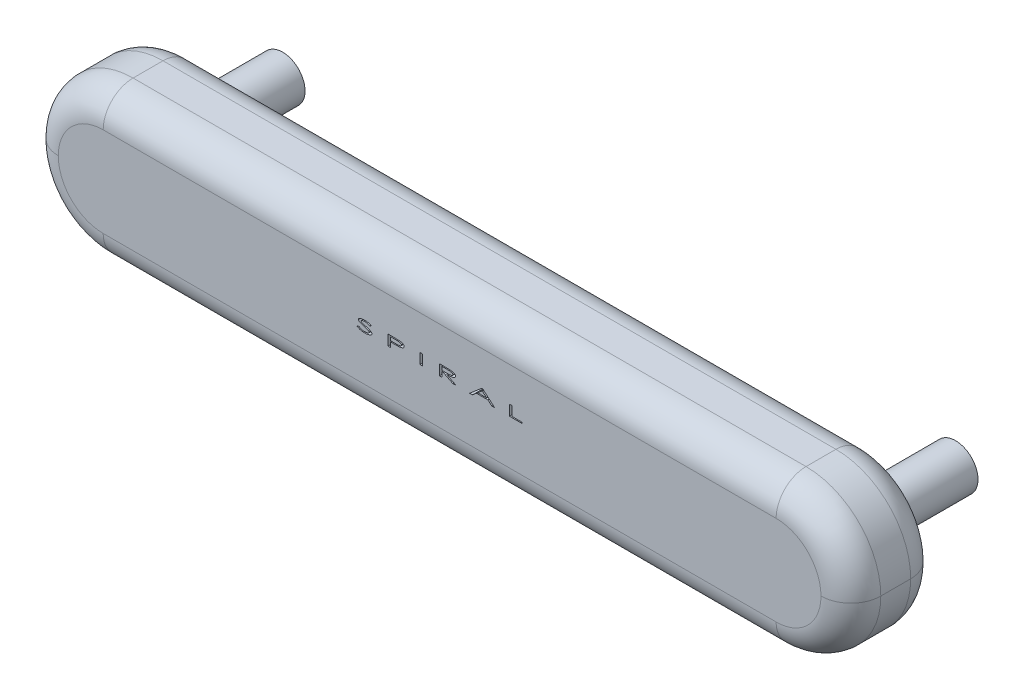
from build123d import *

# Parameters (mm, degrees)
CROQUIS1_W              = 275
CROQUIS1_H              = 50
SALIENTE_EXTRUIR1_DEPTH = 30
REDONDEO1_R             = 25
CROQUIS1_3_R            = 7.5
SALIENTE_EXTRUIR2_DEPTH = 30
CROQUIS1_4_R            = 7.5
SALIENTE_EXTRUIR3_DEPTH = 30
REDONDEO2_R             = 10
CROQUIS2_W              = 0.852564103
CROQUIS2_H              = 3.5
CORTAR_EXTRUIR1_DEPTH   = 5


with BuildPart() as part:
    # Croquis1 → Saliente-Extruir1 (new body)
    with BuildSketch(Plane.XY):
        with Locations((137.5, 25)):
            Rectangle(CROQUIS1_W, CROQUIS1_H)
    extrude(amount=SALIENTE_EXTRUIR1_DEPTH)

    # Redondeo1
    redondeo1_edges = [part.edges().sort_by_distance(p)[0] for p in [
        (0, 0, 15),
        (275, 0, 15),
        (275, 50, 15),
        (0, 50, 15),
    ]]
    fillet(redondeo1_edges, radius=REDONDEO1_R - 0.0001)  # a hair under: the kernel refuses the full size

    # Croquis1<3> → Saliente-Extruir2 (add)
    with BuildSketch(Plane.XY):
        with Locations((25, 25)):
            Circle(CROQUIS1_3_R)
    extrude(amount=-SALIENTE_EXTRUIR2_DEPTH)

    # Croquis1<4> → Saliente-Extruir3 (add)
    with BuildSketch(Plane.XY):
        with Locations((250, 25)):
            Circle(CROQUIS1_4_R)
    extrude(amount=-SALIENTE_EXTRUIR3_DEPTH)

    # Redondeo2
    redondeo2_edges = [part.edges().sort_by_distance(p)[0] for p in [
        (137.5, 0, 0),
        (137.5, 0, 30),
        (137.5, 50, 0),
        (7.322301181, 42.677698819, 0),
        (7.322301181, 7.322301181, 0),
        (267.677698819, 42.677698819, 0),
        (267.677698819, 7.322301181, 0),
        (137.5, 50, 30),
        (7.322301181, 42.677698819, 30),
        (7.322301181, 7.322301181, 30),
        (267.677698819, 42.677698819, 30),
        (267.677698819, 7.322301181, 30),
    ]]
    fillet(redondeo2_edges, radius=REDONDEO2_R)

    # Croquis2 → Cortar-Extruir1 (cut)
    # profile 1 of 6: a face of its own
    with BuildSketch(Plane.XY.offset(30)):
        with BuildLine():
            Line((109.802884615, 25.675180288), (110.536959135, 25.852564103))
            add(Edge.make_bspline(
                [(110.536959135, 25.852564103), (110.603044846, 25.805828861), (110.734369473, 25.712957223), (110.943876839, 25.594805352), (111.160227488, 25.494137976), (111.384361447, 25.411607905), (111.616140434, 25.347897571), (111.855733395, 25.302388435), (112.102828894, 25.274339612), (112.270292046, 25.270946473), (112.354967949, 25.269230769)],
                knots=[0, 0, 0, 0, 0.999301894, 1.985799148, 2.966122564, 3.944318318, 4.932550154, 5.931868728, 6.954272153, 8, 8, 8, 8], degree=3))
            add(Edge.make_bspline(
                [(112.354967949, 25.269230769), (112.42744769, 25.270073359), (112.570239543, 25.271733338), (112.780813218, 25.287844155), (112.984747368, 25.312536432), (113.149235156, 25.342702646), (113.275472364, 25.370635948), (113.363900341, 25.393715362), (113.446428386, 25.41886844), (113.523107947, 25.445615468), (113.594239542, 25.473363633), (113.659352371, 25.503714483), (113.719253895, 25.534794066), (113.77264678, 25.568753157), (113.820047894, 25.603336862), (113.86126467, 25.638800043), (113.896551455, 25.674394161), (113.925594573, 25.710654454), (113.947590417, 25.747864145), (113.964360698, 25.785034855), (113.973553814, 25.823617873), (113.975160491, 25.849483757), (113.975961538, 25.862379808)],
                knots=[0, 0, 0, 0, 2.367074415, 4.663357471, 6.89414542, 9.07428078, 10.122529426, 11.116827178, 12.058601515, 12.939798767, 13.76907445, 14.551229421, 15.285422679, 15.971613976, 16.615933781, 17.200503758, 17.745717994, 18.251221677, 18.713364822, 19.154409607, 19.578410831, 20, 20, 20, 20], degree=3))
            add(Edge.make_bspline(
                [(113.975961538, 25.862379808), (113.974935201, 25.87697753), (113.972837256, 25.906816854), (113.957734234, 25.950991646), (113.934097852, 25.994839045), (113.901379938, 26.038623042), (113.85872399, 26.081517943), (113.806075417, 26.122897678), (113.745937353, 26.16642286), (113.700923787, 26.192325822), (113.677283654, 26.205929487)],
                knots=[0, 0, 0, 0, 0.736359725, 1.505198915, 2.334101288, 3.245211585, 4.255006149, 5.379339436, 6.623686787, 8, 8, 8, 8], degree=3))
            add(Edge.make_bspline(
                [(113.677283654, 26.205929487), (113.659353605, 26.215868566), (113.621950549, 26.236602024), (113.562370302, 26.266383337), (113.497706616, 26.297418913), (113.427538278, 26.328896438), (113.351959809, 26.36096233), (113.271328205, 26.393932352), (113.185248287, 26.427641108), (113.094049035, 26.462733165), (112.997098103, 26.497512471), (112.89528568, 26.53352359), (112.787824659, 26.569668402), (112.675438912, 26.607860659), (112.557127002, 26.645307324), (112.434227168, 26.68494594), (112.305439201, 26.723884083), (112.21801184, 26.750456417), (112.173377404, 26.764022436)],
                knots=[0, 0, 0, 0, 0.612393141, 1.277485318, 1.989516678, 2.755157347, 3.574766992, 4.44217155, 5.357538282, 6.336544056, 7.361359407, 8.434551716, 9.562815989, 10.748468678, 11.980556757, 13.270100396, 14.606299784, 16, 16, 16, 16], degree=3))
            add(Edge.make_bspline(
                [(112.173377404, 26.764022436), (112.128751495, 26.777617555), (112.041619775, 26.804161913), (111.913767239, 26.842377727), (111.792768468, 26.880222738), (111.678450683, 26.917068717), (111.570147644, 26.950874921), (111.46882952, 26.985113252), (111.373294417, 27.015904442), (111.285116845, 27.047448568), (111.202706485, 27.075604863), (111.127311847, 27.104089908), (111.057706369, 27.129753271), (110.994814262, 27.154243656), (110.938274114, 27.177167046), (110.888852142, 27.199960272), (110.845205169, 27.219711012), (110.818984366, 27.233653634), (110.806891026, 27.240084135)],
                knots=[0, 0, 0, 0, 1.545897092, 3.018351337, 4.421902659, 5.746937448, 6.998507922, 8.181390747, 9.290802915, 10.324396982, 11.284528217, 12.176458524, 12.994961478, 13.742817654, 14.413019439, 15.01614685, 15.546235448, 16, 16, 16, 16], degree=3))
            add(Edge.make_bspline(
                [(110.806891026, 27.240084135), (110.770080063, 27.260303489), (110.700185021, 27.298695112), (110.605566475, 27.362657837), (110.523863706, 27.426127745), (110.458767513, 27.493443284), (110.405385436, 27.55997438), (110.369754666, 27.630087331), (110.345141463, 27.700722362), (110.342596874, 27.749138917), (110.341346154, 27.772936699)],
                knots=[0, 0, 0, 0, 1.358038866, 2.578584679, 3.692160972, 4.697396056, 5.603309455, 6.438660662, 7.232567997, 8, 8, 8, 8], degree=3))
            add(Edge.make_bspline(
                [(110.341346154, 27.772936699), (110.342064647, 27.791726572), (110.343502134, 27.829319451), (110.358117854, 27.884570309), (110.378768795, 27.939214276), (110.409724818, 27.991921237), (110.448584478, 28.043622291), (110.496766894, 28.09300688), (110.552739858, 28.141854207), (110.617061591, 28.189093345), (110.689229682, 28.234524345), (110.768995146, 28.277357522), (110.85582617, 28.317516169), (110.949060631, 28.356568983), (111.049807774, 28.391103242), (111.157135259, 28.424071174), (111.271423018, 28.454978453), (111.43466637, 28.492438018), (111.64857788, 28.53134989), (111.914561749, 28.566129721), (112.191551459, 28.585445985), (112.379712558, 28.588293221), (112.475560897, 28.58974359)],
                knots=[0, 0, 0, 0, 0.460405938, 0.921133675, 1.395388169, 1.891534112, 2.41607595, 2.980276919, 3.582238422, 4.238791046, 4.937766679, 5.674725507, 6.460354842, 7.286326003, 8.155716285, 9.074272011, 10.043204283, 11.062236692, 13.186309529, 15.379476941, 17.646328254, 20, 20, 20, 20], degree=3))
            add(Edge.make_bspline(
                [(112.475560897, 28.58974359), (112.577503318, 28.58835169), (112.778403016, 28.585608649), (113.074800444, 28.561232149), (113.361040061, 28.521283346), (113.593554257, 28.475462405), (113.776368878, 28.428190301), (113.915016548, 28.387151695), (114.05516838, 28.338429773), (114.197384589, 28.283567452), (114.341357991, 28.221890367), (114.487560649, 28.153742308), (114.635458579, 28.078686344), (114.733788522, 28.024682325), (114.783653846, 27.997295673)],
                knots=[0, 0, 0, 0, 1.521020812, 2.997502144, 4.434208615, 5.832201361, 6.530880114, 7.25140359, 7.98924051, 8.744404629, 9.525629069, 10.32602435, 11.151089316, 12, 12, 12, 12], degree=3))
            Line((114.783653846, 27.997295673), (114.079026442, 27.782051282))
            add(Edge.make_bspline(
                [(114.079026442, 27.782051282), (114.038261149, 27.804274519), (113.958675178, 27.847660885), (113.84004822, 27.906853411), (113.72669664, 27.961182082), (113.617665477, 28.008958827), (113.513374313, 28.051025699), (113.413591656, 28.087679938), (113.31853476, 28.118820632), (113.196727839, 28.15146721), (113.043875198, 28.184178236), (112.855069444, 28.211174186), (112.658375757, 28.227505564), (112.524671087, 28.229668528), (112.456630609, 28.230769231)],
                knots=[0, 0, 0, 0, 0.980337606, 1.913910424, 2.799102258, 3.634409705, 4.427111586, 5.173398302, 5.87881715, 6.53845457, 7.835481288, 9.17688944, 10.563357661, 12, 12, 12, 12], degree=3))
            add(Edge.make_bspline(
                [(112.456630609, 28.230769231), (112.412923532, 28.230299219), (112.327576288, 28.229381422), (112.202410189, 28.224155602), (112.083642591, 28.213434212), (111.970938766, 28.199364468), (111.864067885, 28.182382761), (111.763564405, 28.159757971), (111.668897637, 28.133963638), (111.581345705, 28.104142979), (111.502010619, 28.071495959), (111.432153346, 28.037687449), (111.373238361, 28.001189499), (111.324860127, 27.962414236), (111.2863771, 27.922014881), (111.25858492, 27.879188083), (111.242436045, 27.833872524), (111.239992408, 27.802967708), (111.238782051, 27.787660256)],
                knots=[0, 0, 0, 0, 1.517070092, 2.962397858, 4.346732628, 5.654693746, 6.904227172, 8.100795781, 9.22842913, 10.308373245, 11.30860669, 12.204639, 12.999123415, 13.708554952, 14.351372882, 14.927469995, 15.468765608, 16, 16, 16, 16], degree=3))
            add(Edge.make_bspline(
                [(111.238782051, 27.787660256), (111.240439896, 27.768776184), (111.243840001, 27.730046472), (111.26725589, 27.67297708), (111.305896976, 27.618378847), (111.347637783, 27.573492547), (111.390811311, 27.539630912), (111.42909812, 27.511209693), (111.474320008, 27.483669797), (111.524960651, 27.454741866), (111.581677628, 27.425239128), (111.645227311, 27.396215629), (111.714110281, 27.365116941), (111.762678784, 27.345544337), (111.787760417, 27.335436699)],
                knots=[0, 0, 0, 0, 0.907853707, 1.861934888, 2.922122969, 4.114982742, 4.794473583, 5.559038982, 6.407523186, 7.339014998, 8.364787121, 9.481355444, 10.699327498, 12, 12, 12, 12], degree=3))
            add(Edge.make_bspline(
                [(111.787760417, 27.335436699), (111.795949622, 27.33242586), (111.814202035, 27.325715188), (111.844427573, 27.313835692), (111.881547316, 27.303152447), (111.923649218, 27.287138738), (111.972743637, 27.272706033), (112.027537153, 27.254788528), (112.088448638, 27.23511627), (112.155565329, 27.214213257), (112.22880593, 27.191836237), (112.307901662, 27.167104333), (112.393254376, 27.141320983), (112.484724654, 27.114045941), (112.58203193, 27.084336867), (112.685757998, 27.05390066), (112.795179185, 27.020555018), (112.870275479, 26.998374042), (112.908854167, 26.986979167)],
                knots=[0, 0, 0, 0, 0.356713724, 0.795057133, 1.326833629, 1.934174987, 2.635212013, 3.417771439, 4.290963286, 5.251895696, 6.291490936, 7.421701509, 8.639723694, 9.93644018, 11.323755665, 12.798923915, 14.355533842, 16, 16, 16, 16], degree=3))
            add(Edge.make_bspline(
                [(112.908854167, 26.986979167), (112.954915494, 26.973025087), (113.045262319, 26.945654907), (113.177764773, 26.904245714), (113.304699609, 26.863663436), (113.42615255, 26.823467034), (113.542352141, 26.784764252), (113.652654717, 26.745018972), (113.757670296, 26.706670856), (113.857093117, 26.669026588), (113.950663661, 26.631483038), (114.039091393, 26.59551263), (114.121470134, 26.558678961), (114.199165055, 26.523862094), (114.270888323, 26.48892772), (114.337288096, 26.454733893), (114.397336057, 26.419941506), (114.469873767, 26.377501159), (114.550045907, 26.32296618), (114.636182602, 26.257926639), (114.708183946, 26.19122507), (114.768625624, 26.126025865), (114.815128999, 26.059192317), (114.848464982, 25.992484525), (114.869830662, 25.92514034), (114.872219441, 25.879820719), (114.873397436, 25.857471955)],
                knots=[0, 0, 0, 0, 1.465622365, 2.874739772, 4.227425773, 5.523763526, 6.770588987, 7.956899197, 9.093939721, 10.175152002, 11.194092472, 12.164191172, 13.081917256, 13.941859919, 14.756710256, 15.511139054, 16.215571939, 16.869788332, 18.069915647, 19.166016233, 20.153194536, 21.055138089, 21.868495227, 22.622823312, 23.320863784, 24, 24, 24, 24], degree=3))
            add(Edge.make_bspline(
                [(114.873397436, 25.857471955), (114.872879584, 25.841539064), (114.871851752, 25.80991549), (114.862857996, 25.762889182), (114.849047935, 25.716701122), (114.82900413, 25.671419599), (114.80360609, 25.627029198), (114.772426179, 25.583712795), (114.73654745, 25.540397432), (114.694173883, 25.498575023), (114.646331045, 25.457221373), (114.593131659, 25.416424149), (114.533707965, 25.377685656), (114.470049427, 25.337740782), (114.399648902, 25.300376827), (114.324059643, 25.263342648), (114.243021986, 25.226625337), (114.126517484, 25.178886731), (113.97228911, 25.123788207), (113.778756683, 25.066342215), (113.575585612, 25.017981414), (113.36256359, 24.97897367), (113.139832013, 24.948370481), (112.907590362, 24.925999091), (112.665729497, 24.912397806), (112.501286707, 24.910979966), (112.417367788, 24.91025641)],
                knots=[0, 0, 0, 0, 0.408365711, 0.810523548, 1.22396232, 1.642756068, 2.077756279, 2.53353516, 3.010204836, 3.518898733, 4.058616592, 4.631760099, 5.236989457, 5.877558991, 6.558883948, 7.280106935, 8.036738639, 8.84054028, 10.509266481, 12.235372807, 14.016628891, 15.86388167, 17.788458921, 19.782060598, 21.847489026, 24, 24, 24, 24], degree=3))
            add(Edge.make_bspline(
                [(112.417367788, 24.91025641), (112.352386019, 24.910756805), (112.224003203, 24.911745423), (112.03371846, 24.920759914), (111.847742796, 24.933378471), (111.666381569, 24.95350116), (111.489519852, 24.977642765), (111.317413987, 25.007923463), (111.149921276, 25.043516921), (110.986637395, 25.085030648), (110.827043027, 25.132361864), (110.671381289, 25.188084665), (110.518679715, 25.250438645), (110.369394397, 25.320870586), (110.222467561, 25.397884262), (110.079025838, 25.482928291), (109.938158193, 25.574437388), (109.848109563, 25.64149971), (109.802884615, 25.675180288)],
                knots=[0, 0, 0, 0, 1.123519158, 2.219708013, 3.293326598, 4.346048509, 5.37415993, 6.379342228, 7.36688953, 8.334247009, 9.29183175, 10.244046751, 11.191835519, 12.142711933, 13.09711952, 14.059068445, 15.025209738, 16, 16, 16, 16], degree=3))
        make_face()
    # profile 2 of 6: a face of its own
    with BuildSketch(Plane.XY.offset(30)):
        with BuildLine():
            Line((120.280448718, 28.5), (121.997495994, 28.5))
            add(Edge.make_bspline(
                [(121.997495994, 28.5), (122.0577925, 28.500048557), (122.175815205, 28.500143601), (122.349227989, 28.499463208), (122.514924588, 28.497940277), (122.673141778, 28.496386565), (122.823899932, 28.495639368), (122.967137192, 28.49194525), (123.102952499, 28.490726055), (123.231004377, 28.486693861), (123.351831283, 28.48324943), (123.465196435, 28.479964164), (123.571066798, 28.475692091), (123.669245744, 28.471041537), (123.75985744, 28.464783887), (123.843164529, 28.460745688), (123.918830708, 28.454012123), (123.966715482, 28.449535156), (123.989383013, 28.447415865)],
                knots=[0, 0, 0, 0, 1.452065154, 2.842231946, 4.176153244, 5.442539161, 6.652645809, 7.806638123, 8.893004127, 9.923341683, 10.891794056, 11.803990064, 12.654512792, 13.443439437, 14.170866806, 14.841775526, 15.451723662, 16, 16, 16, 16], degree=3))
            add(Edge.make_bspline(
                [(123.989383013, 28.447415865), (124.04950023, 28.440835282), (124.167186595, 28.427953035), (124.339273393, 28.401737063), (124.503056001, 28.371255355), (124.658386408, 28.335490965), (124.805118471, 28.294948578), (124.943467238, 28.249476455), (125.07341569, 28.199046305), (125.194194011, 28.144202774), (125.3038429, 28.085469347), (125.400221695, 28.022602347), (125.481174742, 27.955098644), (125.548835716, 27.884673891), (125.600428514, 27.809151337), (125.637613533, 27.729921613), (125.661462123, 27.646946447), (125.663859796, 27.589867574), (125.665064103, 27.561197917)],
                knots=[0, 0, 0, 0, 1.42316458, 2.786008259, 4.095624247, 5.343128405, 6.536126679, 7.67713533, 8.769030102, 9.815091879, 10.797068987, 11.694066505, 12.518022811, 13.272901944, 13.985349948, 14.659552387, 15.326718066, 16, 16, 16, 16], degree=3))
            add(Edge.make_bspline(
                [(125.665064103, 27.561197917), (125.663827391, 27.532301737), (125.661377707, 27.475064011), (125.638221866, 27.391667715), (125.60222151, 27.31228336), (125.551265074, 27.236973983), (125.486013763, 27.166060615), (125.40633794, 27.099185511), (125.312656354, 27.036298956), (125.205109273, 26.977866968), (125.085331625, 26.923815848), (124.954613769, 26.87311005), (124.812856528, 26.827944712), (124.660308727, 26.787224077), (124.496874128, 26.751983205), (124.322726782, 26.720254488), (124.137679411, 26.693843571), (124.010460679, 26.679984623), (123.94521234, 26.672876603)],
                knots=[0, 0, 0, 0, 0.66346391, 1.314193301, 1.975824916, 2.661737534, 3.396243974, 4.18582484, 5.049198632, 5.987586105, 6.99805441, 8.070348716, 9.211196653, 10.418802225, 11.701131559, 13.056219936, 14.490184901, 16, 16, 16, 16], degree=3))
            add(Edge.make_bspline(
                [(123.94521234, 26.672876603), (123.919513266, 26.670434063), (123.865351504, 26.66528632), (123.779991218, 26.659400863), (123.686540809, 26.652805987), (123.585096105, 26.647311286), (123.475698464, 26.642638766), (123.358394948, 26.637495152), (123.233120355, 26.633353516), (123.0998935, 26.630102286), (122.958745978, 26.626285945), (122.809627944, 26.623830194), (122.652351321, 26.620757379), (122.487116647, 26.618705786), (122.313935295, 26.617535872), (122.132815138, 26.615893686), (121.943743766, 26.615248778), (121.814970623, 26.615338738), (121.749298878, 26.615384615)],
                knots=[0, 0, 0, 0, 0.563907102, 1.188455372, 1.869023119, 2.610428344, 3.40766825, 4.261014542, 5.175389916, 6.145746992, 7.172244821, 8.259881435, 9.40366776, 10.608633609, 11.869702578, 13.186928909, 14.565389619, 16, 16, 16, 16], degree=3))
            Line((121.749298878, 26.615384615), (121.133012821, 26.615384615))
            Line((121.133012821, 26.615384615), (121.133012821, 25))
            Line((121.133012821, 25), (120.280448718, 25))
            Line((120.280448718, 25), (120.280448718, 28.5))
        make_face()
        with BuildLine():
            Line((121.133012821, 28.141025641), (121.133012821, 26.974358974))
            Line((121.133012821, 26.974358974), (122.592748397, 26.966646635))
            add(Edge.make_bspline(
                [(122.592748397, 26.966646635), (122.664031411, 26.966630562), (122.801699356, 26.966599522), (123.00081854, 26.97059789), (123.185237668, 26.975142936), (123.354712652, 26.981959708), (123.509176522, 26.991352922), (123.648843198, 27.001086158), (123.773595539, 27.014833206), (123.88528341, 27.029009465), (123.986589297, 27.047397297), (124.081027943, 27.066366259), (124.169744464, 27.089265092), (124.253213187, 27.113389236), (124.331217431, 27.140646216), (124.403566618, 27.171079012), (124.470786785, 27.202837621), (124.532060744, 27.237439519), (124.587244367, 27.273274164), (124.635085862, 27.311126626), (124.675467449, 27.349899208), (124.708959654, 27.38936831), (124.735521676, 27.430153023), (124.753623766, 27.472693099), (124.765778385, 27.515887525), (124.767014434, 27.545226936), (124.767628205, 27.559795673)],
                knots=[0, 0, 0, 0, 2.142522754, 4.137825984, 5.985957158, 7.687367645, 9.235481332, 10.637347691, 11.894834411, 13.007522912, 14.020361103, 14.988868417, 15.902069929, 16.773406883, 17.599868506, 18.383925138, 19.131709799, 19.833118015, 20.497493259, 21.107463914, 21.663874683, 22.1774417, 22.660713575, 23.12006188, 23.563059165, 24, 24, 24, 24], degree=3))
            add(Edge.make_bspline(
                [(124.767628205, 27.559795673), (124.767038111, 27.57413789), (124.765858632, 27.602805084), (124.753470667, 27.645005463), (124.735509953, 27.686650291), (124.708957558, 27.726762193), (124.675206917, 27.765480223), (124.635338962, 27.804336276), (124.586969099, 27.841289666), (124.532138459, 27.87736944), (124.471184472, 27.911231547), (124.405747416, 27.944016689), (124.335231197, 27.97285731), (124.260149267, 27.999797736), (124.180606931, 28.024145703), (124.096162465, 28.045923707), (124.007021172, 28.064766398), (123.911362662, 28.081118145), (123.805869564, 28.095095003), (123.686899706, 28.107792893), (123.552683467, 28.118024175), (123.403060539, 28.126131085), (123.238295941, 28.133290584), (123.058316644, 28.137978018), (122.862923561, 28.14082782), (122.727598583, 28.140957979), (122.657251603, 28.141025641)],
                knots=[0, 0, 0, 0, 0.442674685, 0.884817273, 1.351144542, 1.842649343, 2.365909491, 2.938801886, 3.562368517, 4.246423439, 4.968608299, 5.719034203, 6.510181141, 7.324623638, 8.187137073, 9.083555023, 10.022637691, 11.005993137, 12.086163304, 13.315404159, 14.70831514, 16.251324397, 17.952548439, 19.812043201, 21.822943539, 24, 24, 24, 24], degree=3))
            Line((122.657251603, 28.141025641), (121.133012821, 28.141025641))
        make_face(mode=Mode.SUBTRACT)
    # profile 3 of 6: a face of its own
    with BuildSketch(Plane.XY.offset(30)):
        with Locations((131.363782052, 26.75)):
            Rectangle(CROQUIS2_W, CROQUIS2_H)
    # profile 4 of 6: a face of its own
    with BuildSketch(Plane.XY.offset(30)):
        with BuildLine():
            Line((137.421474359, 28.5), (139.150440705, 28.5))
            add(Edge.make_bspline(
                [(139.150440705, 28.5), (139.209568798, 28.500070241), (139.325254679, 28.50020767), (139.495158685, 28.499224789), (139.65758788, 28.498777974), (139.812772249, 28.497383384), (139.960704259, 28.49511936), (140.101395878, 28.493013767), (140.234850347, 28.491091006), (140.361056821, 28.488320352), (140.480004451, 28.484672963), (140.591715742, 28.481144568), (140.695965791, 28.477845783), (140.792964317, 28.47369784), (140.882452046, 28.468576812), (140.964754262, 28.463969339), (141.039751701, 28.458196616), (141.087408583, 28.454216718), (141.110076122, 28.452323718)],
                knots=[0, 0, 0, 0, 1.447513378, 2.832103213, 4.15947959, 5.423960048, 6.631296777, 7.781425608, 8.868626489, 9.898732157, 10.871790205, 11.781941973, 12.634909937, 13.425208605, 14.158641683, 14.829242103, 15.443140243, 16, 16, 16, 16], degree=3))
            add(Edge.make_bspline(
                [(141.110076122, 28.452323718), (141.172999332, 28.446022857), (141.29630869, 28.433675186), (141.476106038, 28.40752719), (141.647046394, 28.376657911), (141.808881324, 28.341470102), (141.961530096, 28.299778658), (142.10527023, 28.253735848), (142.240364268, 28.202869134), (142.364935284, 28.146207455), (142.478599561, 28.087218559), (142.577126213, 28.022656861), (142.66091163, 27.954924435), (142.730749656, 27.884570378), (142.783999126, 27.809203251), (142.823123141, 27.730988814), (142.846328819, 27.648514301), (142.849416571, 27.592186308), (142.850961538, 27.564002404)],
                knots=[0, 0, 0, 0, 1.446424159, 2.834528544, 4.15474672, 5.419427177, 6.621638102, 7.772979837, 8.871111456, 9.921473686, 10.902006625, 11.797596097, 12.61083074, 13.36318367, 14.057369682, 14.712475299, 15.355782592, 16, 16, 16, 16], degree=3))
            add(Edge.make_bspline(
                [(142.850961538, 27.564002404), (142.850164228, 27.540291125), (142.848574172, 27.493004284), (142.831122487, 27.423758709), (142.805626473, 27.356214792), (142.767053128, 27.29216904), (142.720220288, 27.229307413), (142.661505764, 27.16941536), (142.592896144, 27.111557001), (142.513940453, 27.056182281), (142.425365791, 27.003898069), (142.32781192, 26.954062195), (142.220938602, 26.907970201), (142.10505874, 26.865233074), (141.980143061, 26.826451965), (141.846521145, 26.789616849), (141.703739772, 26.757142932), (141.55110969, 26.727316183), (141.386645231, 26.701685149), (141.20835398, 26.67815585), (141.015110976, 26.660081764), (140.80711774, 26.643647344), (140.584329589, 26.631314444), (140.346380694, 26.622308355), (140.093710076, 26.616668586), (139.920275405, 26.615820198), (139.831229968, 26.615384615)],
                knots=[0, 0, 0, 0, 0.503317736, 1.003754633, 1.510595538, 2.034130965, 2.587947849, 3.175101599, 3.813556362, 4.494930901, 5.22390086, 5.99985628, 6.823672935, 7.698218743, 8.625891248, 9.60519755, 10.645935196, 11.739873159, 12.912727555, 14.186080425, 15.56474174, 17.04071722, 18.624158805, 20.310708322, 22.105830933, 24, 24, 24, 24], degree=3))
            Line((139.831229968, 26.615384615), (142.940705128, 25))
            Line((142.940705128, 25), (141.862379808, 25))
            Line((141.862379808, 25), (138.752203526, 26.615384615))
            Line((138.752203526, 26.615384615), (138.274038462, 26.615384615))
            Line((138.274038462, 26.615384615), (138.274038462, 25))
            Line((138.274038462, 25), (137.421474359, 25))
            Line((137.421474359, 25), (137.421474359, 28.5))
        make_face()
        with BuildLine():
            Line((138.274038462, 28.141025641), (138.274038462, 26.974358974))
            Line((138.274038462, 26.974358974), (139.775841346, 26.969451122))
            add(Edge.make_bspline(
                [(139.775841346, 26.969451122), (139.846189616, 26.969435455), (139.982221885, 26.969405159), (140.179003108, 26.973408735), (140.361555929, 26.977923679), (140.52984992, 26.984897569), (140.684132307, 26.993869389), (140.824173224, 27.004911833), (140.949985282, 27.018019353), (141.06290059, 27.03362005), (141.166068439, 27.051189663), (141.262109577, 27.07166029), (141.352441404, 27.093868531), (141.437182082, 27.118470775), (141.516194766, 27.145459255), (141.589169886, 27.175619248), (141.656234645, 27.208159128), (141.717854321, 27.242112225), (141.773125786, 27.278211511), (141.820987041, 27.316027585), (141.861364001, 27.354808688), (141.894857304, 27.394275769), (141.921419059, 27.435060973), (141.939521215, 27.477600927), (141.951675818, 27.520795383), (141.952911869, 27.550134791), (141.953525641, 27.564703526)],
                knots=[0, 0, 0, 0, 2.1119765, 4.083923552, 5.908873173, 7.594292989, 9.140614403, 10.548396697, 11.811404688, 12.937655877, 13.970058596, 14.952618383, 15.88517887, 16.762240683, 17.600997965, 18.390626413, 19.131223972, 19.837942073, 20.501548161, 21.110812644, 21.666579248, 22.179551701, 22.662264086, 23.121080597, 23.563565018, 24, 24, 24, 24], degree=3))
            add(Edge.make_bspline(
                [(141.953525641, 27.564703526), (141.952911836, 27.579035203), (141.951684962, 27.60768133), (141.939690675, 27.64992946), (141.920334418, 27.690825439), (141.894180497, 27.730941043), (141.860540919, 27.770105755), (141.819017816, 27.807550853), (141.770181, 27.843963698), (141.714884117, 27.879547101), (141.653747927, 27.913464695), (141.587547694, 27.945222455), (141.516409763, 27.973691575), (141.440747417, 28.000562572), (141.360057145, 28.023931871), (141.275065106, 28.045994638), (141.185417038, 28.06466182), (141.089326458, 28.081195575), (140.983119836, 28.095117882), (140.862747979, 28.107817267), (140.726427057, 28.118036721), (140.574000271, 28.12614183), (140.40596292, 28.133281074), (140.221778127, 28.1380014), (140.021710559, 28.140818321), (139.882880293, 28.140954851), (139.810897436, 28.141025641)],
                knots=[0, 0, 0, 0, 0.437359585, 0.874193462, 1.331361263, 1.816964671, 2.333942147, 2.905477287, 3.522881613, 4.194820874, 4.914569407, 5.659283665, 6.438215648, 7.256346892, 8.113284703, 9.005860074, 9.940658209, 10.912206718, 11.986489438, 13.215183343, 14.612743407, 16.165765119, 17.882260618, 19.755145155, 21.799062208, 24, 24, 24, 24], degree=3))
            Line((139.810897436, 28.141025641), (138.274038462, 28.141025641))
        make_face(mode=Mode.SUBTRACT)
    # profile 5 of 6: a face of its own
    with BuildSketch(Plane.XY.offset(30)):
        Polygon((151.84775641, 28.5), (155.886217949, 25), (154.946013622, 25), (153.651742788, 26.121794872), (149.791366186, 26.121794872), (148.482371795, 25), (147.540064103, 25), (151.623397436, 28.5), align=None)
        Polygon((151.732071314, 27.785556891), (150.209234776, 26.480769231), (153.237379808, 26.480769231), align=None, mode=Mode.SUBTRACT)
    # profile 6 of 6: a face of its own
    with BuildSketch(Plane.XY.offset(30)):
        Polygon((160.844551282, 28.5), (161.697115385, 28.5), (161.697115385, 25.358974359), (165.0625, 25.358974359), (165.0625, 25), (160.844551282, 25), align=None)
    extrude(amount=-CORTAR_EXTRUIR1_DEPTH, mode=Mode.SUBTRACT)


solid = part.part
